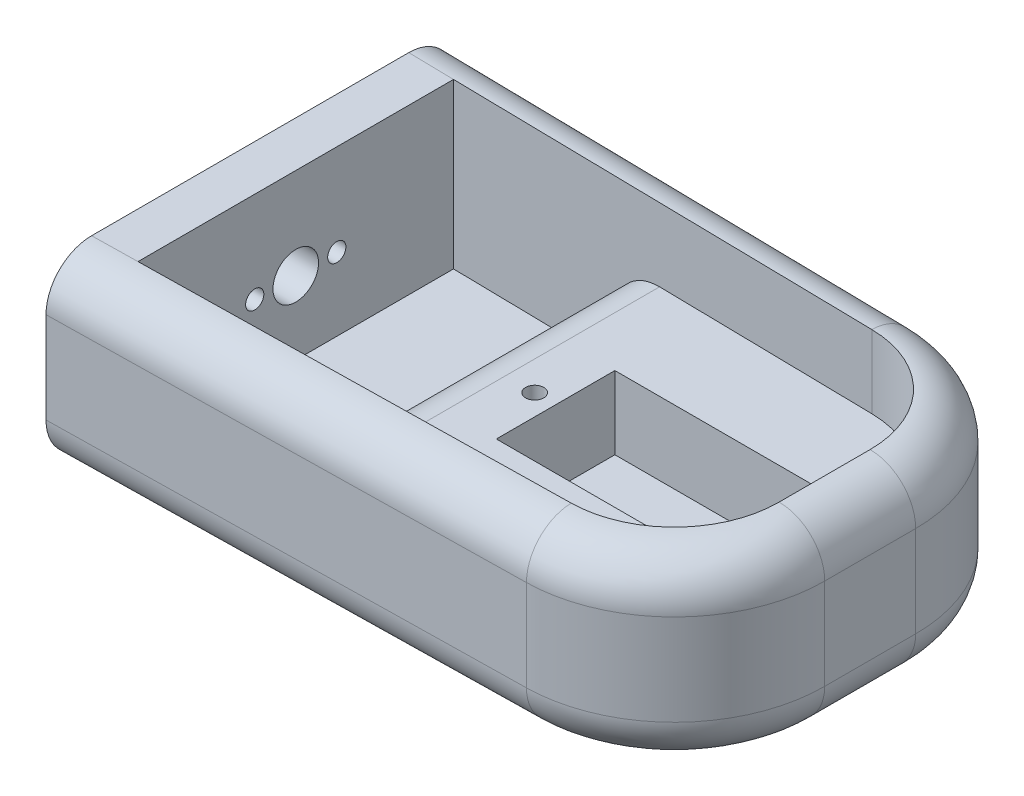
from build123d import *

# Parameters (mm, degrees)
BOSS_EXTRUDE1_DEPTH      = 20
SHELL1_T                 = -5
SHELL1_THICKNESS_2_DEPTH = 3
BOSS_EXTRUDE2_DEPTH      = 10
SKETCH7_W                = 23
SKETCH7_H                = 13
CUT_EXTRUDE1_DEPTH       = 8
SKETCH8_R                = 6.5
CUT_EXTRUDE2_DEPTH       = 8
SKETCH9_R                = 1
CUT_EXTRUDE3_DEPTH       = 8
SKETCH10_R               = 2.5
SKETCH10_R_2             = 1
CUT_EXTRUDE4_DEPTH       = 8
FILLET1_R                = 5


with BuildPart() as part:
    # Sketch2 → Boss-Extrude1 (new body)
    with BuildSketch(Plane(origin=(0, 0, 0), x_dir=(1, 0, 0), z_dir=(0, 1, 0))):
        with BuildLine():
            Line((0, 0), (0, 44.78))
            Line((0, 44.78), (51.787964706, 43.876037714))
            ThreePointArc((51.787964706, 43.876037714), (63.268632411, 38.943553604), (68, 27.378550743))
            Line((68, 27.378550743), (68, 17.401449257))
            ThreePointArc((68, 17.401449257), (63.268632411, 5.836446396), (51.787964706, 0.903962286))
            Line((51.787964706, 0.903962286), (0, 0))
        make_face()
    extrude(amount=BOSS_EXTRUDE1_DEPTH)

    # Shell1
    shell1_openings = [part.faces().sort_by_distance(p)[0] for p in [
        (32.484056968, 20, -22.39),
    ]]
    offset(amount=SHELL1_T, openings=shell1_openings, kind=Kind.INTERSECTION)

    # Shell1 thickness 2 face (on inner face of the shell) → Shell1 thickness 2 (cut)
    with BuildSketch(Plane(origin=(32.938254764, 5, -22.39), x_dir=(0, 0, -1), z_dir=(0, -1, 0))):
        with BuildLine():
            Line((-17.301963035, -27.938254764), (-16.486799238, 18.76244791))
            ThreePointArc((-16.486799238, 18.76244791), (-13.049007283, 26.764125401), (-4.988550743, 30.061745236))
            Line((-4.988550743, 30.061745236), (4.988550743, 30.061745236))
            ThreePointArc((4.988550743, 30.061745236), (13.049007283, 26.764125401), (16.486799238, 18.76244791))
            Line((16.486799238, 18.76244791), (17.301963035, -27.938254764))
            Line((17.301963035, -27.938254764), (-17.301963035, -27.938254764))
        make_face()
    extrude(amount=SHELL1_THICKNESS_2_DEPTH, mode=Mode.SUBTRACT)

    # Sketch6 → Boss-Extrude2 (add)
    with BuildSketch(Plane(origin=(0, 2, 0), x_dir=(1, 0, 0), z_dir=(0, 1, 0))):
        with BuildLine():
            Line((23, 39.377771866), (23, 5.402228134))
            Line((23, 5.402228134), (51.700702674, 5.903200762))
            ThreePointArc((51.700702674, 5.903200762), (59.702380165, 9.340992717), (63, 17.401449257))
            Line((63, 17.401449257), (63, 27.378550743))
            ThreePointArc((63, 27.378550743), (59.702380165, 35.439007283), (51.700702674, 38.876799238))
            Line((51.700702674, 38.876799238), (23, 39.377771866))
        make_face()
    extrude(amount=BOSS_EXTRUDE2_DEPTH)

    # Sketch7 → Cut-Extrude1 (cut)
    with BuildSketch(Plane(origin=(0, 12, 0), x_dir=(1, 0, 0), z_dir=(0, 1, 0))):
        with Locations((45, 22.39)):
            Rectangle(SKETCH7_W, SKETCH7_H)
    extrude(amount=-CUT_EXTRUDE1_DEPTH, mode=Mode.SUBTRACT)

    # Sketch8 → Cut-Extrude2 (cut)
    with BuildSketch(Plane(origin=(0, 4, 0), x_dir=(1, 0, 0), z_dir=(0, 1, 0))):
        with Locations(Location((50, 22.39, 0), (0, 0, 90))):
            Circle(SKETCH8_R)
    extrude(amount=-CUT_EXTRUDE2_DEPTH, mode=Mode.SUBTRACT)

    # Sketch9 → Cut-Extrude3 (cut)
    with BuildSketch(Plane(origin=(0, 12, 0), x_dir=(1, 0, 0), z_dir=(0, 1, 0))):
        with Locations(Location((31.2, 22.39, 0), (0, 0, 270))):
            Circle(SKETCH9_R)
        with Locations(Location((58.8, 22.39, 0), (0, 0, 270))):
            Circle(SKETCH9_R)
    extrude(amount=-CUT_EXTRUDE3_DEPTH, mode=Mode.SUBTRACT)

    # Sketch10 → Cut-Extrude4 (cut)
    with BuildSketch(Plane(origin=(5, 0, 0), x_dir=(0, 0, -1), z_dir=(1, 0, 0))):
        with Locations((22.39, 10)):
            Circle(SKETCH10_R)
        with Locations((17.89, 10)):
            Circle(SKETCH10_R_2)
        with Locations((26.89, 10)):
            Circle(SKETCH10_R_2)
    extrude(amount=-CUT_EXTRUDE4_DEPTH, mode=Mode.SUBTRACT)

    # Fillet1
    fillet1_edges = [part.edges().sort_by_distance(p)[0] for p in [
        (68, 20, -22.39),
        (63.268632411, 20, -38.943553604),
        (25.893982353, 20, -44.328018857),
        (23, 12, -22.39),
        (25.893982353, 20, -0.451981143),
        (25.893982353, 0, -44.328018857),
        (63.268632411, 0, -38.943553604),
        (68, 0, -22.39),
        (63.268632411, 0, -5.836446396),
        (25.893982353, 0, -0.451981143),
        (63.268632411, 20, -5.836446396),
    ]]
    fillet(fillet1_edges, radius=FILLET1_R - 0.0001)  # a hair under: the kernel refuses the full size


solid = part.part
